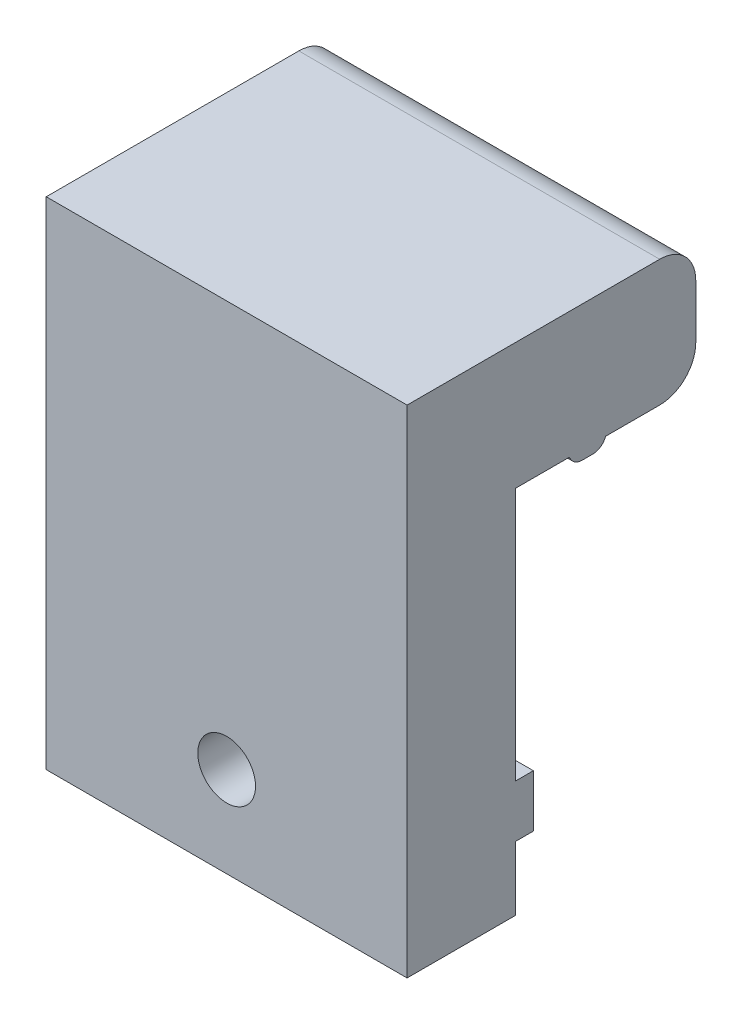
from build123d import *

# Parameters (mm, degrees)
ESQUISSE1_W             = 20
ESQUISSE1_H             = 27.5
BOSS_EXTRU_1_DEPTH      = 6
ESQUISSE2_W             = 20
ESQUISSE2_H             = 7
BOSS_EXTRU_2_DEPTH      = 10
CONG_2_R                = 2
ESQUISSE3_W             = 20
ESQUISSE3_H             = 2.9
BOSS_EXTRU_3_DEPTH      = 1
ESQUISSE4_R             = 1.6
ENL_V_MAT_EXTRU_1_DEPTH = 24.346573624
ESQUISSE6_W             = 20
ESQUISSE6_H             = 2
BOSS_EXTRU_5_DEPTH      = 0.5
CONG_4_R                = 0.75


with BuildPart() as part:
    # Esquisse1 → Boss.-Extru.1 (new body)
    with BuildSketch(Plane.XY):
        Rectangle(ESQUISSE1_W, ESQUISSE1_H)
    extrude(amount=BOSS_EXTRU_1_DEPTH)

    # Esquisse2 → Boss.-Extru.2 (add)
    with BuildSketch(Plane(origin=(0, 0, 0), x_dir=(-1, 0, 0), z_dir=(0, 0, -1))):
        with Locations((0, 10.25)):
            Rectangle(ESQUISSE2_W, ESQUISSE2_H)
    extrude(amount=BOSS_EXTRU_2_DEPTH)

    # Congé2
    cong_2_edges = [part.edges().sort_by_distance(p)[0] for p in [
        (0, 6.75, -10),
        (0, 13.75, -10),
    ]]
    fillet(cong_2_edges, radius=CONG_2_R)

    # Esquisse3 → Boss.-Extru.3 (add)
    with BuildSketch(Plane(origin=(0, 0, 0), x_dir=(-1, 0, 0), z_dir=(0, 0, -1))):
        with Locations((0, -8.75)):
            Rectangle(ESQUISSE3_W, ESQUISSE3_H)
    extrude(amount=BOSS_EXTRU_3_DEPTH)

    # Esquisse4 → Enlèv. mat.-Extru.1 (cut, through all)
    with BuildSketch(Plane.XY.offset(6)):
        with Locations((0, -8.75)):
            Circle(ESQUISSE4_R)
    extrude(amount=-ENL_V_MAT_EXTRU_1_DEPTH, mode=Mode.SUBTRACT)

    # Esquisse6 → Boss.-Extru.5 (add)
    with BuildSketch(Plane.XZ.offset(-6.75)):
        with Locations((0, -4)):
            Rectangle(ESQUISSE6_W, ESQUISSE6_H)
    extrude(amount=BOSS_EXTRU_5_DEPTH)

    # Congé4
    # the kernel refuses this fillet: 0.75 mm, written as the material it takes off along each edge
    with BuildSketch(Plane(origin=(-11.767766953, 6.25, -5), x_dir=(0, 1, 0), z_dir=(1, 0, 0)), Plane(origin=(11.767766953, 6.25, -3), x_dir=(0, 1, 0), z_dir=(-1, 0, 0))) as cong_4_piece_1:
        with BuildLine():
            CenterArc((0.75, 0.707106781), CONG_4_R, 180, 70.528779366)
            Line((0, 0.707106781), (-0.015, 0.707106781))
            Line((-0.015, 0.707106781), (-0.015, 0))
            Line((-0.015, 0), (0, -0.015))
            ThreePointArc((0, -0.015), (0.25, -0.015), (0.495, -0.014142136))
            Line((0.495, -0.014142136), (0.5, 0))
        make_face()
    extrude(amount=23.535533906, mode=Mode.SUBTRACT)


solid = part.part
